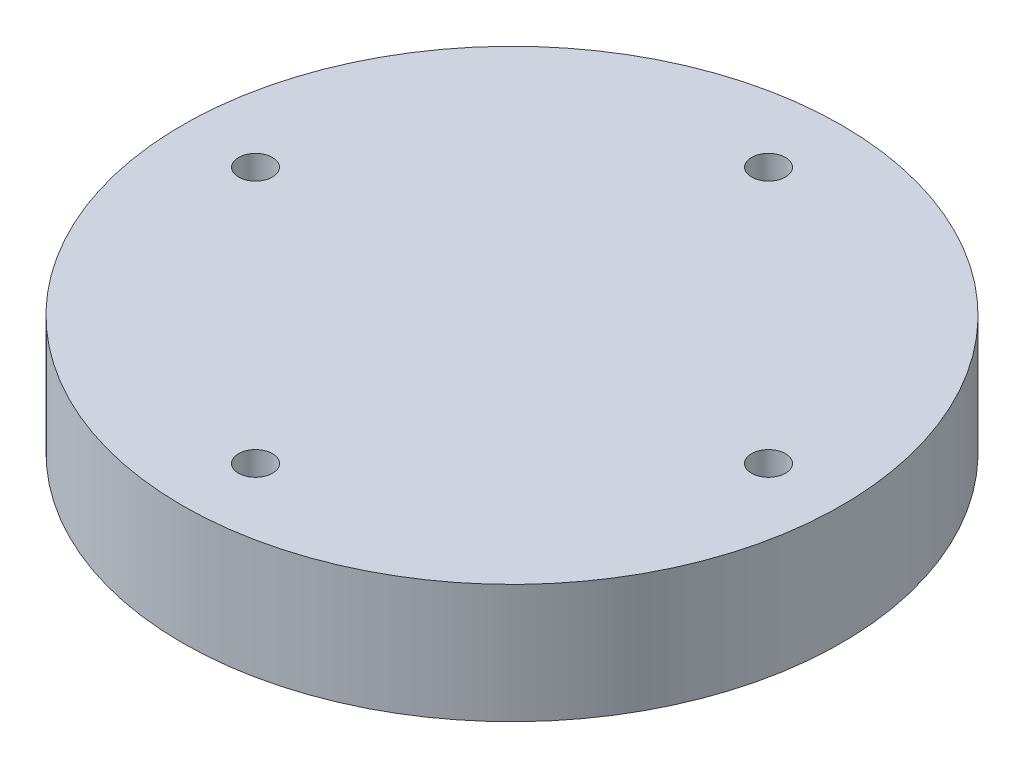
from build123d import *

# Parameters (mm, degrees)
SKETCH1_R           = 19.4
SKETCH1_R_2         = 1
BOSS_EXTRUDE1_DEPTH = 7
WRAP1_DEPTH         = 0.5


# Read off the part's stored shape, not the designer's step: Wrap1
with BuildPart() as part:
    # Sketch1 → Boss-Extrude1 (new body)
    with BuildSketch(Plane(origin=(0, 0, 0), x_dir=(1, 0, 0), z_dir=(0, 1, 0))):
        with Locations(Location((0, 0, 0), (0, 0, 270))):
            Circle(SKETCH1_R)
        with Locations(Location((0, 15.1, 0), (0, 0, 270))):
            Circle(SKETCH1_R_2, mode=Mode.SUBTRACT)
        with Locations(Location((15.1, 0, 0), (0, 0, 270))):
            Circle(SKETCH1_R_2, mode=Mode.SUBTRACT)
        with Locations(Location((0, -15.1, 0), (0, 0, 270))):
            Circle(SKETCH1_R_2, mode=Mode.SUBTRACT)
        with Locations(Location((-15.1, 0, 0), (0, 0, 270))):
            Circle(SKETCH1_R_2, mode=Mode.SUBTRACT)
    extrude(amount=BOSS_EXTRUDE1_DEPTH)

    # Wrap1 outline → Wrap1 (cut)
    # profile 1 of 12: a face of its own
    with BuildSketch(Plane(origin=(0, 0, 0), x_dir=(1, 0, 0), z_dir=(0, 1, 0))):
        with BuildLine():
            Line((-2.576923077, 7.687890169), (-3.263321314, 7.687890169))
            add(Edge.make_bspline(
                [(-3.263321314, 7.687890169), (-3.31053222, 7.687838273), (-3.400990413, 7.687738838), (-3.530705469, 7.684724092), (-3.6485152, 7.6806974), (-3.754165581, 7.675115507), (-3.847981679, 7.668518916), (-3.929538979, 7.659266877), (-3.999478535, 7.649606581), (-4.041384985, 7.639785175), (-4.060496795, 7.635306035)],
                knots=[0, 0, 0, 0, 0.176955752, 0.33905508, 0.486318225, 0.618780923, 0.735618828, 0.838742477, 0.926457068, 1, 1, 1, 1], degree=3))
            add(Edge.make_bspline(
                [(-4.060496795, 7.635306035), (-4.084690329, 7.628684085), (-4.132507306, 7.615596223), (-4.201408349, 7.5893825), (-4.266962194, 7.558300335), (-4.329393753, 7.522876395), (-4.387935836, 7.481590831), (-4.443461877, 7.436117213), (-4.495481857, 7.385405644), (-4.543703249, 7.330024904), (-4.587988047, 7.270904695), (-4.626117729, 7.207162465), (-4.658044956, 7.139871161), (-4.685428228, 7.06907759), (-4.705136682, 6.994187267), (-4.719983582, 6.915720554), (-4.72940721, 6.833685864), (-4.730309771, 6.777625997), (-4.730769231, 6.749088086)],
                knots=[0, 0, 0, 0, 0.062481339, 0.123490383, 0.183411094, 0.243153221, 0.302126735, 0.361709671, 0.421842292, 0.482931901, 0.544552254, 0.60568072, 0.667679738, 0.729984388, 0.794550921, 0.86034562, 0.928907356, 1, 1, 1, 1], degree=3))
            add(Edge.make_bspline(
                [(-4.730769231, 6.749088086), (-4.730347806, 6.720310309), (-4.72952326, 6.664004645), (-4.719626975, 6.581631857), (-4.706296783, 6.502913467), (-4.685799731, 6.428024017), (-4.658954058, 6.357408246), (-4.627462005, 6.289987014), (-4.589478475, 6.226907342), (-4.545833645, 6.167940225), (-4.49728205, 6.113030312), (-4.444029112, 6.062575518), (-4.38628982, 6.016871179), (-4.324247672, 5.975814836), (-4.257297823, 5.940358556), (-4.186455669, 5.908601251), (-4.111105453, 5.881930191), (-4.058962939, 5.867900129), (-4.032451923, 5.860766772)],
                knots=[0, 0, 0, 0, 0.070118894, 0.137192353, 0.202016181, 0.264631407, 0.326116547, 0.386010305, 0.445811847, 0.505297697, 0.564633278, 0.624282625, 0.683902032, 0.743952771, 0.805387731, 0.868388031, 0.933084028, 1, 1, 1, 1], degree=3))
            add(Edge.make_bspline(
                [(-4.032451923, 5.860766772), (-4.010524589, 5.856103791), (-3.962469562, 5.845884597), (-3.88332684, 5.83447614), (-3.791181454, 5.824738539), (-3.686159174, 5.817437402), (-3.568354269, 5.811187033), (-3.437703011, 5.806218939), (-3.293948934, 5.803489085), (-3.19367769, 5.803348293), (-3.141326122, 5.803274785)],
                knots=[0, 0, 0, 0, 0.075173117, 0.164746258, 0.268016881, 0.385911876, 0.517789479, 0.663690977, 0.824413221, 1, 1, 1, 1], degree=3))
            Line((-3.141326122, 5.803274785), (-2.891025641, 5.803274785))
            Line((-2.891025641, 5.803274785), (-2.891025641, 4.187890169))
            Line((-2.891025641, 4.187890169), (-2.576923077, 4.187890169))
            Line((-2.576923077, 4.187890169), (-2.576923077, 7.687890169))
        make_face()
        with BuildLine():
            Line((-2.891025641, 6.162249144), (-3.50380609, 6.154536804))
            add(Edge.make_bspline(
                [(-3.50380609, 6.154536804), (-3.533726016, 6.15452134), (-3.591485815, 6.154491488), (-3.674922039, 6.158476712), (-3.752331326, 6.163077244), (-3.823475901, 6.169813168), (-3.888387836, 6.179334425), (-3.947175365, 6.188946163), (-3.999382648, 6.202851526), (-4.060481849, 6.221574595), (-4.128565197, 6.253507211), (-4.202632745, 6.299857101), (-4.265403332, 6.358937809), (-4.319721629, 6.42536564), (-4.362827506, 6.49926477), (-4.394383499, 6.578333706), (-4.412924656, 6.661761556), (-4.41541085, 6.718849695), (-4.416666667, 6.747685843)],
                knots=[0, 0, 0, 0, 0.072538371, 0.140033831, 0.202495681, 0.260575056, 0.313228338, 0.361583194, 0.404878361, 0.444127437, 0.516399693, 0.586506671, 0.655085374, 0.724383783, 0.793973529, 0.861637682, 0.930110942, 1, 1, 1, 1], degree=3))
            add(Edge.make_bspline(
                [(-4.416666667, 6.747685843), (-4.41540402, 6.775824356), (-4.412894035, 6.831760238), (-4.394238172, 6.913738999), (-4.362888858, 6.991974703), (-4.319432264, 7.064947788), (-4.266691134, 7.131136592), (-4.205391791, 7.18863372), (-4.135678529, 7.234855422), (-4.070830298, 7.264688704), (-4.013229112, 7.282903979), (-3.963197152, 7.29564882), (-3.906706478, 7.305824426), (-3.843738698, 7.314063929), (-3.774781864, 7.32111739), (-3.69924355, 7.325903367), (-3.617409906, 7.328704824), (-3.560599335, 7.328843779), (-3.53114984, 7.32891581)],
                knots=[0, 0, 0, 0, 0.070043755, 0.139238317, 0.208197455, 0.279173374, 0.349986812, 0.418353846, 0.487609584, 0.557411073, 0.595330157, 0.637964052, 0.685912778, 0.738185165, 0.796102647, 0.858516544, 0.926657726, 1, 1, 1, 1], degree=3))
            Line((-3.53114984, 7.32891581), (-2.891025641, 7.32891581))
            Line((-2.891025641, 7.32891581), (-2.891025641, 6.162249144))
        make_face(mode=Mode.SUBTRACT)
    # profile 2 of 12: a face of its own
    with BuildSketch(Plane(origin=(0, 0, 0), x_dir=(1, 0, 0), z_dir=(0, 1, 0))):
        with BuildLine():
            add(Edge.make_bspline(
                [(0.003205128, 7.777633759), (-0.061602978, 7.77599228), (-0.188891445, 7.772768279), (-0.375966342, 7.748089175), (-0.554561438, 7.705393785), (-0.726131576, 7.648530803), (-0.888624553, 7.572676418), (-1.043263446, 7.480991269), (-1.189680319, 7.37251481), (-1.325901701, 7.248085584), (-1.450558651, 7.11270213), (-1.560384537, 6.96822422), (-1.652426831, 6.815525417), (-1.728012618, 6.655064587), (-1.787311228, 6.487204619), (-1.828230272, 6.311050616), (-1.854368422, 6.127743926), (-1.857424199, 6.002717061), (-1.858974359, 5.939292413)],
                knots=[0, 0, 0, 0, 0.066570035, 0.130749041, 0.1934128, 0.254989399, 0.316113556, 0.377261758, 0.439400784, 0.502970589, 0.566524976, 0.628231103, 0.689090611, 0.749344669, 0.810169593, 0.871609824, 0.934869184, 1, 1, 1, 1], degree=3))
            add(Edge.make_bspline(
                [(-1.858974359, 5.939292413), (-1.857424426, 5.876334967), (-1.85436933, 5.752238546), (-1.828200552, 5.570095102), (-1.787159552, 5.395004406), (-1.728563286, 5.227258753), (-1.653337808, 5.066681189), (-1.560682637, 4.913694235), (-1.451541426, 4.768247737), (-1.327334575, 4.631935072), (-1.191933533, 4.506937601), (-1.046703266, 4.398018725), (-0.894909946, 4.304294601), (-0.734600238, 4.229510927), (-0.567900201, 4.169739006), (-0.393317878, 4.128986376), (-0.211671324, 4.102699333), (-0.08780032, 4.099680817), (-0.024839744, 4.09814658)],
                knots=[0, 0, 0, 0, 0.065226504, 0.128568996, 0.190320378, 0.251377989, 0.312387528, 0.373788704, 0.43643116, 0.500566755, 0.564686795, 0.627135518, 0.688455409, 0.749245746, 0.810155177, 0.871670926, 0.934773496, 1, 1, 1, 1], degree=3))
            add(Edge.make_bspline(
                [(-0.024839744, 4.09814658), (0.038584575, 4.099695967), (0.163610791, 4.10275022), (0.347147827, 4.128931625), (0.523425571, 4.169872929), (0.691939922, 4.228382365), (0.852784851, 4.303999596), (1.006274934, 4.396203975), (1.151794081, 4.505611116), (1.288135828, 4.629777691), (1.412885026, 4.764949243), (1.521644402, 4.909783498), (1.613869515, 5.061438955), (1.689232847, 5.220336479), (1.748897307, 5.385707921), (1.789602125, 5.558656399), (1.815938077, 5.738195905), (1.818972924, 5.860438803), (1.820512821, 5.92246549)],
                knots=[0, 0, 0, 0, 0.065818877, 0.129746527, 0.192071954, 0.253459424, 0.314569588, 0.376279881, 0.439025654, 0.503267029, 0.567492823, 0.629704796, 0.690999649, 0.751451651, 0.812004364, 0.873149681, 0.935635484, 1, 1, 1, 1], degree=3))
            add(Edge.make_bspline(
                [(1.820512821, 5.92246549), (1.819978185, 5.964098159), (1.818915659, 6.046838283), (1.806123966, 6.169704883), (1.787562265, 6.290595541), (1.760960352, 6.409166488), (1.726168685, 6.525127473), (1.685116658, 6.639278236), (1.634976813, 6.75046196), (1.578296165, 6.859205351), (1.515034357, 6.963813257), (1.445158607, 7.06269284), (1.371123239, 7.156673837), (1.289959845, 7.243320841), (1.2043434, 7.325154497), (1.112885022, 7.400917215), (1.016142777, 7.471292165), (0.913700398, 7.534712507), (0.808082123, 7.592071641), (0.699205345, 7.641293492), (0.588548773, 7.683539554), (0.475594126, 7.717780379), (0.360641353, 7.744812415), (0.243439569, 7.763219769), (0.124082143, 7.776044086), (0.043670824, 7.777101588), (0.003205128, 7.777633759)],
                knots=[0, 0, 0, 0, 0.043208986, 0.085872872, 0.128120007, 0.170151964, 0.211917621, 0.253753003, 0.296006409, 0.338443357, 0.381015368, 0.422820479, 0.464089056, 0.505125849, 0.545974971, 0.586985211, 0.628338592, 0.670083802, 0.711991602, 0.753039155, 0.794049395, 0.834885543, 0.875498313, 0.9165473, 0.958003779, 1, 1, 1, 1], degree=3))
        make_face()
        with BuildLine():
            add(Edge.make_bspline(
                [(-0.012219551, 7.4186594), (0.020995082, 7.41825451), (0.087106815, 7.4174486), (0.185391351, 7.406832885), (0.282383285, 7.391702996), (0.378102647, 7.370121475), (0.472148937, 7.340717422), (0.565398778, 7.306876514), (0.657001832, 7.265655423), (0.74665569, 7.219082719), (0.833570765, 7.167533798), (0.915583466, 7.110562031), (0.99290611, 7.049503477), (1.065349377, 6.98421564), (1.132700549, 6.914366038), (1.196285251, 6.841013602), (1.253554832, 6.762061711), (1.306040409, 6.679651304), (1.353008249, 6.593889723), (1.394773604, 6.50567986), (1.428937613, 6.414302173), (1.456799989, 6.320748016), (1.4798998, 6.225165556), (1.494533724, 6.126829707), (1.505266084, 6.026234595), (1.506025929, 5.958252741), (1.506410256, 5.923867734)],
                knots=[0, 0, 0, 0, 0.042023329, 0.083644911, 0.124983795, 0.166247461, 0.207701556, 0.249631071, 0.29174177, 0.334742875, 0.377460169, 0.419556319, 0.461044176, 0.502096284, 0.542890714, 0.583800819, 0.624863583, 0.666224689, 0.707399186, 0.748556678, 0.789654591, 0.830739726, 0.872070142, 0.913993395, 0.95649813, 1, 1, 1, 1], degree=3))
            add(Edge.make_bspline(
                [(1.506410256, 5.923867734), (1.505135394, 5.873305513), (1.502627347, 5.773833982), (1.480669776, 5.628065839), (1.446847802, 5.487977552), (1.396990436, 5.354335643), (1.334639821, 5.22599136), (1.257612931, 5.104083255), (1.166353845, 4.988578381), (1.062690318, 4.880283112), (0.949367612, 4.781437308), (0.829034882, 4.694673899), (0.702981274, 4.621263649), (0.570878072, 4.561458577), (0.433430533, 4.514068839), (0.289752982, 4.481590208), (0.140802522, 4.460214753), (0.039271867, 4.458161997), (-0.012219551, 4.457120939)],
                knots=[0, 0, 0, 0, 0.064503999, 0.126899322, 0.18774654, 0.248149733, 0.308586065, 0.369583005, 0.431826965, 0.496179723, 0.560667855, 0.623504455, 0.685260411, 0.746536822, 0.808327352, 0.870486188, 0.934316883, 1, 1, 1, 1], degree=3))
            add(Edge.make_bspline(
                [(-0.012219551, 4.457120939), (-0.046829053, 4.457596443), (-0.115470089, 4.458539511), (-0.217565612, 4.468038188), (-0.317821823, 4.483270057), (-0.416098103, 4.505200713), (-0.512282915, 4.532647919), (-0.606777718, 4.565255647), (-0.698576008, 4.605936851), (-0.788835846, 4.650884803), (-0.875232088, 4.70212496), (-0.95770762, 4.75716311), (-1.0341836, 4.81813173), (-1.106572671, 4.882449543), (-1.17420036, 4.951413391), (-1.236609344, 5.024933613), (-1.293589476, 5.10347427), (-1.346055123, 5.185759676), (-1.392858386, 5.271755928), (-1.433637485, 5.360285606), (-1.468233601, 5.451130716), (-1.496162106, 5.544422287), (-1.518047567, 5.639983136), (-1.533127487, 5.737941214), (-1.543675926, 5.838100557), (-1.544471003, 5.905844413), (-1.544871795, 5.939993535)],
                knots=[0, 0, 0, 0, 0.043633218, 0.086537777, 0.129177336, 0.171436324, 0.213415895, 0.255265955, 0.297369481, 0.339940748, 0.382347459, 0.423952947, 0.464871163, 0.505572294, 0.546002577, 0.586567975, 0.627064799, 0.668270684, 0.709549225, 0.750428154, 0.791096194, 0.832027145, 0.873135955, 0.914610764, 0.956955986, 1, 1, 1, 1], degree=3))
            add(Edge.make_bspline(
                [(-1.544871795, 5.939993535), (-1.544470682, 5.973909039), (-1.543675, 6.041186689), (-1.533132526, 6.140647508), (-1.518031635, 6.237900719), (-1.496268927, 6.332564522), (-1.468218774, 6.424663047), (-1.433631443, 6.514109795), (-1.392846144, 6.60123799), (-1.346037919, 6.685832287), (-1.293422096, 6.767007025), (-1.235927853, 6.844609437), (-1.172562504, 6.917182179), (-1.10513648, 6.986516873), (-1.031965594, 7.051134762), (-0.9533813, 7.111057283), (-0.870337622, 7.167730557), (-0.782410387, 7.218856119), (-0.691666433, 7.266070352), (-0.598552475, 7.306521355), (-0.504123376, 7.340893474), (-0.408619263, 7.37021044), (-0.311236285, 7.39161847), (-0.212632456, 7.40684652), (-0.112944198, 7.417444905), (-0.045900978, 7.418253284), (-0.012219551, 7.4186594)],
                knots=[0, 0, 0, 0, 0.042915082, 0.085129971, 0.126473319, 0.167453038, 0.207976333, 0.248249378, 0.288749987, 0.329669857, 0.370537287, 0.411128564, 0.451818913, 0.492405877, 0.533485862, 0.575263062, 0.617440613, 0.660671688, 0.703940204, 0.746867522, 0.7890793, 0.831104042, 0.87323799, 0.91516577, 0.957380658, 1, 1, 1, 1], degree=3))
        make_face(mode=Mode.SUBTRACT)
    # profile 3 of 12: a face of its own
    with BuildSketch(Plane(origin=(0, 0, 0), x_dir=(1, 0, 0), z_dir=(0, 1, 0))):
        with BuildLine():
            ThreePointArc((-15.093956132, 0.999981736), (-14.1, 0), (-15.093956132, -0.999981736))
            ThreePointArc((-15.093956132, -0.999981736), (-14.087912264, 0), (-15.093956132, 0.999981736))
        make_face()
    # profile 4 of 12: a face of its own
    with BuildSketch(Plane(origin=(0, 0, 0), x_dir=(1, 0, 0), z_dir=(0, 1, 0))):
        with BuildLine():
            ThreePointArc((-0.999981736, -15.093956132), (0, -14.1), (0.999981736, -15.093956132))
            ThreePointArc((0.999981736, -15.093956132), (0, -14.087912264), (-0.999981736, -15.093956132))
        make_face()
    # profile 5 of 12: a face of its own
    with BuildSketch(Plane(origin=(0, 0, 0), x_dir=(1, 0, 0), z_dir=(0, 1, 0))):
        with BuildLine():
            ThreePointArc((15.093956132, -0.999981736), (14.1, 0), (15.093956132, 0.999981736))
            ThreePointArc((15.093956132, 0.999981736), (14.087912264, 0), (15.093956132, -0.999981736))
        make_face()
    # profile 6 of 12: a face of its own
    with BuildSketch(Plane(origin=(0, 0, 0), x_dir=(1, 0, 0), z_dir=(0, 1, 0))):
        with BuildLine():
            ThreePointArc((0.999981736, 15.093956132), (0, 14.1), (-0.999981736, 15.093956132))
            ThreePointArc((-0.999981736, 15.093956132), (0, 14.087912264), (0.999981736, 15.093956132))
        make_face()
    # profile 7 of 12: a face of its own
    with BuildSketch(Plane(origin=(0, 0, 0), x_dir=(1, 0, 0), z_dir=(0, 1, 0))):
        Polygon((2.942307692, 7.32891581), (2.942307692, 4.187890169), (3.256410256, 4.187890169), (3.256410256, 7.32891581), (4.019230769, 7.32891581), (4.019230769, 7.687890169), (2.179487179, 7.687890169), (2.179487179, 7.32891581), align=None)
    # profile 8 of 12: a face of its own
    with BuildSketch(Plane(origin=(0, 0, 0), x_dir=(1, 0, 0), z_dir=(0, 1, 0))):
        Polygon((0, 18.318298359), (-1, 16.586247551), (1, 16.586247551), align=None)
    # profile 9 of 12: a face of its own
    with BuildSketch(Plane(origin=(0, 0, 0), x_dir=(1, 0, 0), z_dir=(0, 1, 0))):
        Polygon((-12.309401077, 0), (-8.845299462, -2), (-8.845299462, 2), align=None)
    # profile 10 of 12: a face of its own
    with BuildSketch(Plane(origin=(0, 0, 0), x_dir=(1, 0, 0), z_dir=(0, 1, 0))):
        Polygon((0, -12.309401077), (2, -8.845299462), (-2, -8.845299462), align=None)
    # profile 11 of 12: a face of its own
    with BuildSketch(Plane(origin=(0, 0, 0), x_dir=(1, 0, 0), z_dir=(0, 1, 0))):
        Polygon((12.309401077, 0), (8.845299462, 2), (8.845299462, -2), align=None)
    # profile 12 of 12: a face of its own
    with BuildSketch(Plane(origin=(0, 0, 0), x_dir=(1, 0, 0), z_dir=(0, 1, 0))):
        Polygon((0, 12.309401077), (-2, 8.845299462), (2, 8.845299462), align=None)
    extrude(amount=WRAP1_DEPTH, mode=Mode.SUBTRACT)


solid = part.part
